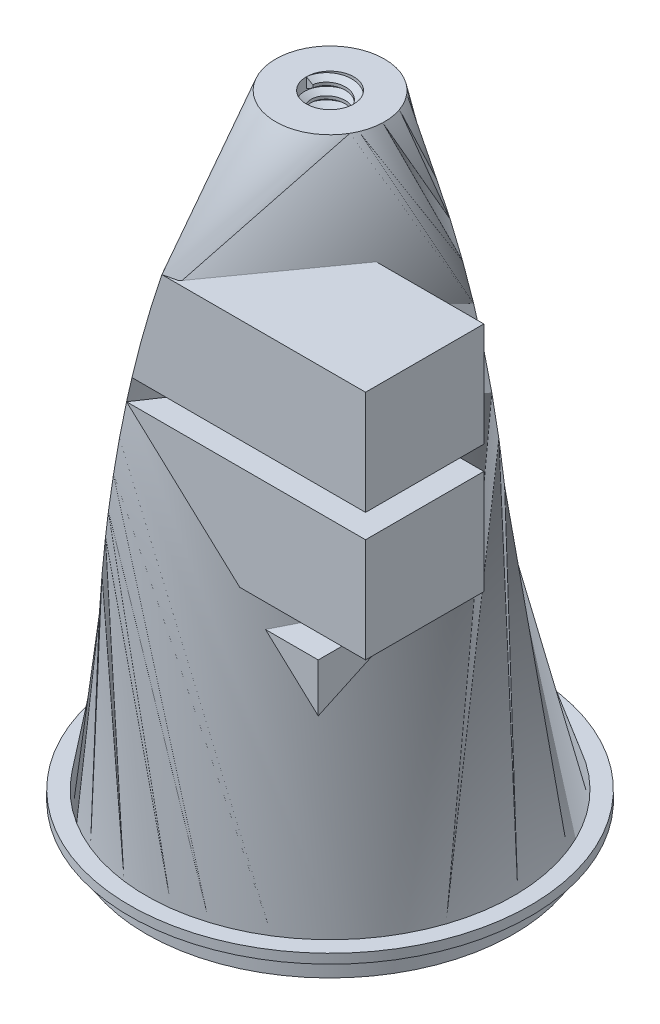
from build123d import *

# Parameters (mm, degrees)
SKETCH1_R               = 38.85
BOSS_EXTRUDE1_DEPTH     = 5
CUT_EXTRUDE1_DEPTH      = 10
CUT_EXTRUDE1_DEPTH_BACK = 40
SKETCH5_W               = 25
SKETCH5_H               = 22
SKETCH6_W               = 25
SKETCH6_H               = 22
CUT_EXTRUDE2_DEPTH      = 10
SKETCH7_W               = 25
SKETCH7_H               = 22
CUT_EXTRUDE3_DEPTH      = 10
SKETCH8_R               = 5
CUT_EXTRUDE4_DEPTH      = 10
THREAD1_PITCH           = 2.5


with BuildPart() as part:
    # Sketch1 → Boss-Extrude1 (new body)
    with BuildSketch(Plane(origin=(0, 0, 0), x_dir=(1, 0, 0), z_dir=(0, 1, 0))):
        with Locations(Location((0, 0, 0), (0, 0, 270))):
            Circle(SKETCH1_R)
    extrude(amount=BOSS_EXTRUDE1_DEPTH)

    # Sketch4 → Revolve2 (revolve)
    with BuildSketch(Plane.XY, mode=Mode.PRIVATE) as revolve2_sk:
        with BuildLine():
            Line((0, 5), (0, 7))
            Line((0, 7), (0, 135))
            Line((0, 135), (-11.5, 135))
            ThreePointArc((-11.5, 135), (-32.240854256, 72.509774327), (-38.85, 7))
            Line((-38.85, 7), (-39.35, 7))
            Line((-39.35, 7), (-42.35, 7))
            Line((-42.35, 7), (-42.35, 5))
            Line((-42.35, 5), (0, 5))
        make_face()
    revolve(revolve2_sk.sketch.rotate(Axis((0, 5, 0), (0, 1, 0)), 270), axis=Axis((0, 5, 0), (0, 1, 0)))

    # Sketch5 → Cut-Extrude1 (cut, two sides: drawn at the far end of the back side and taken through both)
    with BuildSketch(Plane(origin=(0, 0, 0), x_dir=(0, 0, -1), z_dir=(1, 0, 0)).offset(-CUT_EXTRUDE1_DEPTH_BACK)):
        with Locations((0, 58)):
            Rectangle(SKETCH5_W, SKETCH5_H)
        with Locations((0, 85)):
            Rectangle(SKETCH5_W, SKETCH5_H)
        with Locations((0, 31)):
            Rectangle(SKETCH5_W, SKETCH5_H)
    extrude(amount=CUT_EXTRUDE1_DEPTH + CUT_EXTRUDE1_DEPTH_BACK, mode=Mode.SUBTRACT)

    # Sketch6 → Cut-Extrude2 (cut)
    with BuildSketch(Plane.ZY.offset(-10)):
        with Locations((0, 58)):
            Rectangle(SKETCH6_W, SKETCH6_H)
    extrude(amount=-CUT_EXTRUDE2_DEPTH, mode=Mode.SUBTRACT)

    # Sketch7 → Cut-Extrude3 (cut)
    with BuildSketch(Plane.ZY.offset(-10)):
        with Locations((0, 85)):
            Rectangle(SKETCH7_W, SKETCH7_H)
    extrude(amount=-CUT_EXTRUDE3_DEPTH, mode=Mode.SUBTRACT)

    # Sketch8 → Cut-Extrude4 (cut)
    with BuildSketch(Plane(origin=(0, 135, 0), x_dir=(1, 0, 0), z_dir=(0, 1, 0))):
        with Locations(Location((0, 0, 0), (0, 0, 270))):
            Circle(SKETCH8_R)
    extrude(amount=-CUT_EXTRUDE4_DEPTH, mode=Mode.SUBTRACT)

    # Thread1: the profile of Thread Profile1 profile screwed along a right-hand helix of 4 turns, 10 arcs to a turn; built about Z, then put on its axis
    thread1_z = Axis((0, 0, 0), (0, 0, 1))
    thread1_corners = [(5.0003, 0, -0.000173205), (5.0003, 0, 2.187673198), (3.646835312, 0, 1.406249997), (3.646835312, 0, 0.781249997)]
    with BuildLine(mode=Mode.PRIVATE) as thread1_profile:
        Line(thread1_corners[0], thread1_corners[1])
        Line(thread1_corners[1], thread1_corners[2])
        Line(thread1_corners[2], thread1_corners[3])
        Line(thread1_corners[3], thread1_corners[0])
    thread1_cap = Face(thread1_profile.wire())
    thread1_turn_angles = [0, 18, 36, 54, 72, 90, 108, 126, 144, 162, 180, 198, 216, 234, 252, 270, 288, 306, 324, 342, 360]
    thread1_turn_weights = [1, 0.9510565162951535, 1, 0.9510565162951535, 1, 0.9510565162951535, 1, 0.9510565162951535, 1, 0.9510565162951535, 1, 0.9510565162951535, 1, 0.9510565162951535, 1, 0.9510565162951535, 1, 0.9510565162951535, 1, 0.9510565162951535, 1]
    thread1_turn_rails = [Edge.make_bspline([Vector(p[0], p[1], 0).rotate(thread1_z, thread1_turn_angles[k]) / thread1_turn_weights[k] + Vector(0, 0, p[2] + THREAD1_PITCH * thread1_turn_angles[k] / 360) for k in range(21)], [0, 0, 0, 1, 1, 2, 2, 3, 3, 4, 4, 5, 5, 6, 6, 7, 7, 8, 8, 9, 9, 10, 10, 10], 2, thread1_turn_weights) for p in thread1_corners]
    thread1_turn_sides = [Face.make_surface_from_curves(thread1_turn_rails[p[0]], thread1_turn_rails[p[1]]) for p in [(0, 1), (1, 2), (2, 3), (3, 0)]]
    thread1 = Plane(origin=(0, 135, 0), x_dir=(-1, 0, 0), z_dir=(0, -1, 0)) * Solid(Shell([*[p.moved(Location((0, 0, THREAD1_PITCH * i))) for i in range(4) for p in thread1_turn_sides], thread1_cap, thread1_cap.rotate(thread1_z, 1440).moved(Location((0, 0, THREAD1_PITCH * 1440 / 360)))]))
    add(thread1)


solid = part.part
